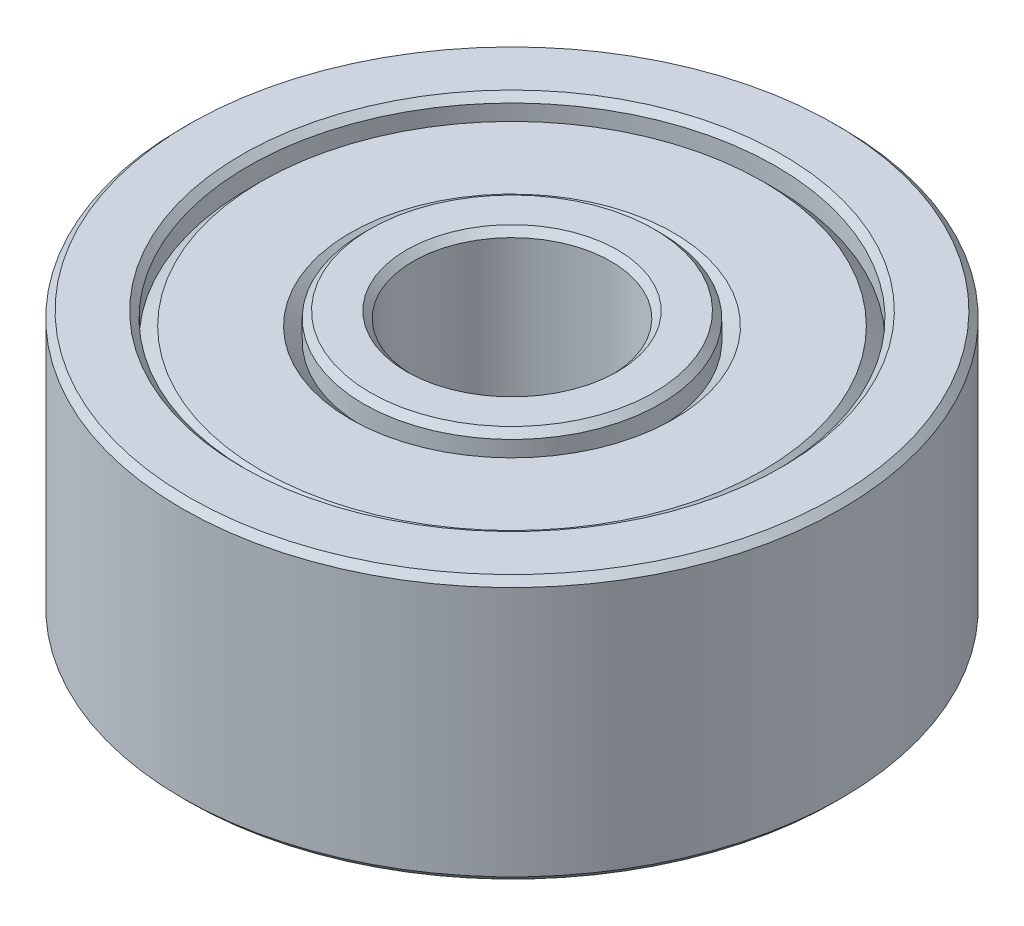
from build123d import *

# Parameters (mm, degrees)
SKETCH1_W     = 3.5
SKETCH1_H     = 4
CHAMFER1_SIZE = 0.1


with BuildPart() as part:
    # Sketch1 → Revolve1 (revolve)
    with BuildSketch(Plane(origin=(0, 0, 0), x_dir=(0, 0, -1), z_dir=(1, 0, 0))):
        with Locations((3.25, 0)):
            Rectangle(SKETCH1_W, SKETCH1_H)
    revolve(axis=Axis((0, 2, 0), (0, -1, 0)))

    # Sketch3 → Cut-Revolve2 (revolve, cut)
    with BuildSketch(Plane(origin=(0, 0, 0), x_dir=(0, 0, -1), z_dir=(1, 0, 0))):
        Polygon((4, 2), (2.25, 2), (2.25, 1.6), (2.45, 1.8), (3.8, 1.8), (4, 1.6), align=None)
    cut_revolve2 = revolve(axis=Axis((0, 2, 0), (0, -1, 0)), mode=Mode.SUBTRACT)

    # Mirror1: Cut-Revolve2 across plane
    add(cut_revolve2.mirror(Plane.ZX), mode=Mode.SUBTRACT)

    # Chamfer1
    chamfer1_edges = [part.edges().sort_by_distance(p)[0] for p in [
        (0, -2, 4),
        (0, 2, 4),
        (0, -2, 5),
        (0, 2, 5),
        (0, -2, 2.25),
        (0, 2, 2.25),
        (0, -2, 1.5),
        (0, 2, 1.5),
    ]]
    chamfer(chamfer1_edges, length=CHAMFER1_SIZE)


solid = part.part
